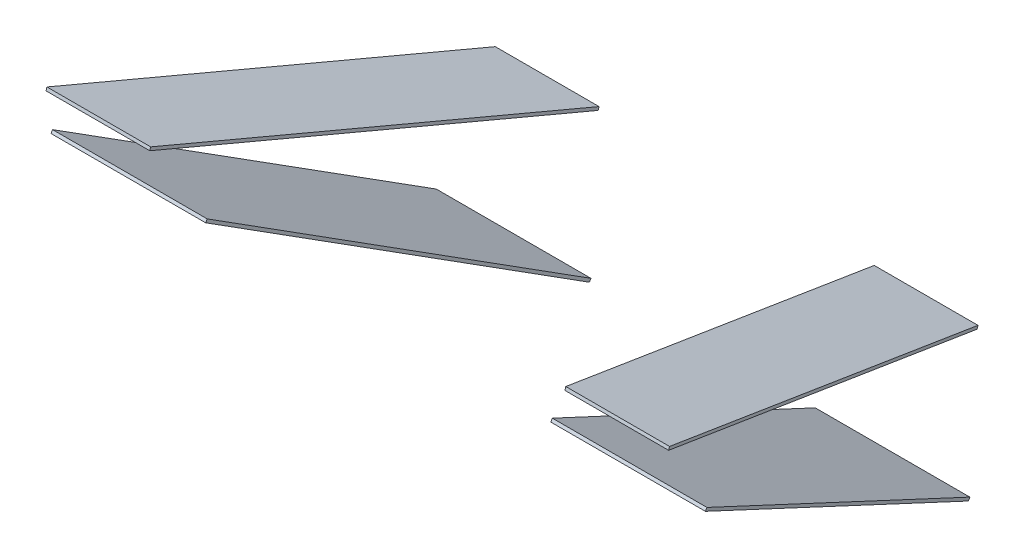
from build123d import *

# Parameters (mm, degrees)
BOSS_EXTRUDE1_DEPTH = 1.5
BOSS_EXTRUDE2_DEPTH = 1.5


with BuildPart() as part:
    # Sketch1 → Boss-Extrude1 (new body)
    with BuildSketch(Plane(origin=(0, 329.699604605, -103.953886026), x_dir=(1, 0, 0), z_dir=(0, 0.9537169507482267, -0.3007057995042738))):
        Polygon((102, 27.217157705), (153, 27.217157705), (118.616238762, 222.217157705), (67.616238762, 222.217157705), align=None)
    extrude(amount=BOSS_EXTRUDE1_DEPTH)


with BuildPart() as body_2:
    # Sketch2 → Boss-Extrude2 (new body)
    with BuildSketch(Plane(origin=(0, 283.022482375, -160.126416143), x_dir=(1, 0, 0), z_dir=(0, -0.8703556959398991, 0.49242356010346816))):
        Polygon((84.810060817, 22.910464575), (160.810060817, 22.910464575), (131.12, -159.691562491), (55.12, -159.691562491), align=None)
    extrude(amount=-BOSS_EXTRUDE2_DEPTH)


with BuildPart() as body_3:
    # Mirror2: mirrored copy
    add(part.part.mirror(Plane(origin=(0, 0, 0), x_dir=(0, 0, 1), z_dir=(1, 0, 0))))


with BuildPart() as body_4:
    # Mirror2 2: mirrored copy
    add(body_2.part.mirror(Plane(origin=(0, 0, 0), x_dir=(0, 0, 1), z_dir=(1, 0, 0))))


solid = Compound([part.part, body_2.part, body_3.part, body_4.part])
